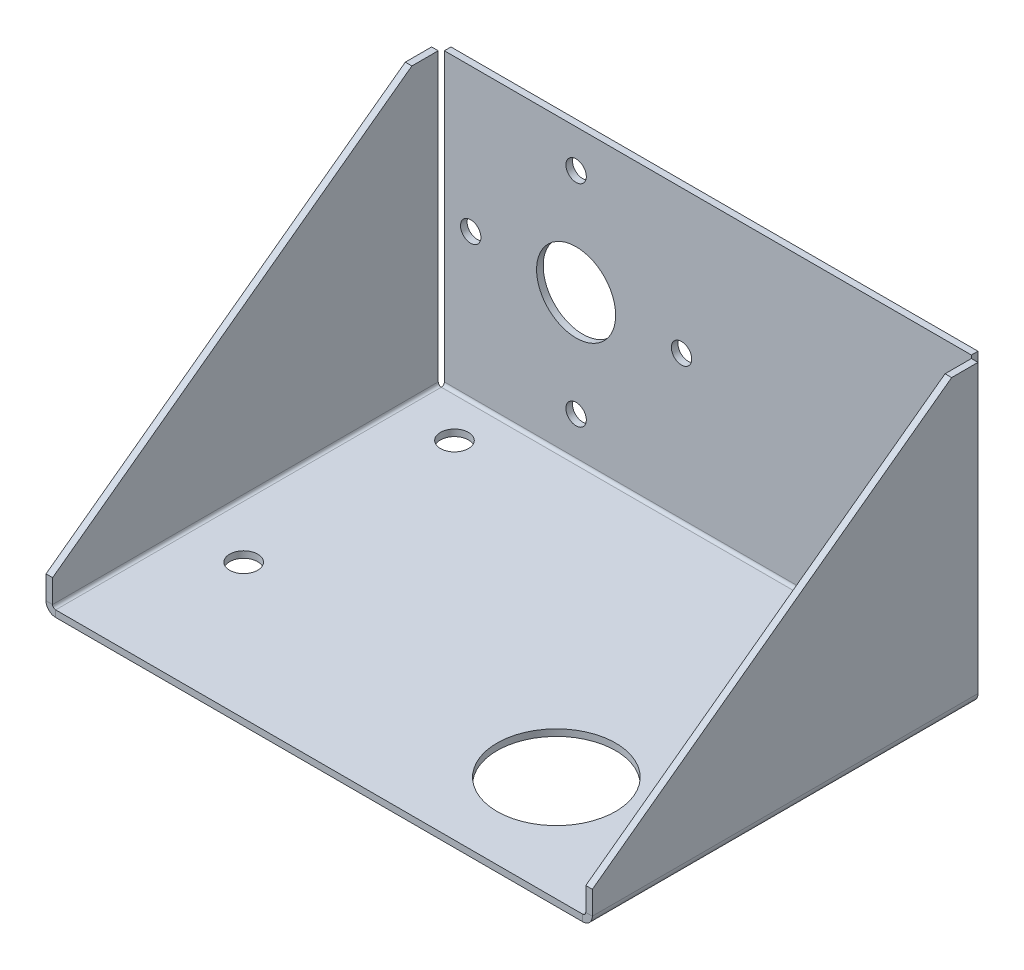
from build123d import *

# Parameters (mm, degrees)
BASE_FLANGE1_DEPTH           = 127
EDGE_FLANGE1_DEPTH           = 92.9259
EDGE_FLANGE1_START           = 1.5875
EDGE_FLANGE1_FLAT_DEPTH      = 1.5875
EDGE_FLANGE1_BEND_DEPTH      = 92.9259
EDGE_FLANGE1_FLAT_2_DEPTH    = 1.5875
SKETCH15_R                   = 14.2875
CUT_EXTRUDE1_DEPTH           = 176.146532483
SKETCH16_R                   = 3.3782
CUT_EXTRUDE2_DEPTH           = 176.146532483
SKETCH17_R                   = 9.525
CUT_EXTRUDE3_DEPTH           = 175.288293488
F_10_0_1935_DIAMETER_HOLE1_D = 4.9149


# Sheet-metal steps are written as plain solids
with BuildPart() as part:
    # Sketch1 → Base-Flange1 (new body)
    with BuildSketch(Plane(origin=(0, 0, 0), x_dir=(0, 0, -1), z_dir=(1, 0, 0))):
        with BuildLine():
            Line((0, 0), (92.9259, 0))
            ThreePointArc((92.9259, 0), (93.446754855, 0.215745145), (93.6625, 0.7366))
            Line((93.6625, 0.7366), (93.6625, 69.85))
            Line((93.6625, 69.85), (95.25, 69.85))
            Line((95.25, 69.85), (95.25, 0.7366))
            ThreePointArc((95.25, 0.7366), (94.56928687, -0.90678687), (92.9259, -1.5875))
            Line((92.9259, -1.5875), (0, -1.5875))
            Line((0, -1.5875), (0, 0))
        make_face()
    extrude(amount=BASE_FLANGE1_DEPTH)

    # Edge-Flange1 bend section (across the edge) → Edge-Flange1 (add)
    with BuildSketch(Plane(origin=(-0.7366, 0, -92.9259), x_dir=(1, 0, 0), z_dir=(0, 0, 1))):
        with BuildLine():
            Line((-1.5875, 0.7366), (0, 0.7366))
            ThreePointArc((0, 0.7366), (0.215745145, 0.215745145), (0.7366, 0))
            Line((0.7366, 0), (0.7366, -1.5875))
            ThreePointArc((0.7366, -1.5875), (-0.90678687, -0.90678687), (-1.5875, 0.7366))
        make_face()
    extrude(amount=EDGE_FLANGE1_DEPTH)

    # Edge-Flange1 profile (on flange) → Edge-Flange1 flat (add)
    with BuildSketch(Plane.ZY.offset(0.7366).offset(EDGE_FLANGE1_START)):
        Polygon((0, 0.7366), (0, 6.35), (-86.5759, 69.85), (-92.9259, 69.85), (-92.9259, 0.7366), align=None)
    extrude(amount=-EDGE_FLANGE1_FLAT_DEPTH)

    # Edge-Flange1 bend section 2 (across the edge) → Edge-Flange1 bend (add)
    with BuildSketch(Plane(origin=(127.7366, 0, 0), x_dir=(-1, 0, 0), z_dir=(0, 0, -1))):
        with BuildLine():
            Line((-1.5875, 0.7366), (0, 0.7366))
            ThreePointArc((0, 0.7366), (0.215745145, 0.215745145), (0.7366, 0))
            Line((0.7366, 0), (0.7366, -1.5875))
            ThreePointArc((0.7366, -1.5875), (-0.90678687, -0.90678687), (-1.5875, 0.7366))
        make_face()
    extrude(amount=EDGE_FLANGE1_BEND_DEPTH)

    # Edge-Flange1 profile 2 (on flange) → Edge-Flange1 flat 2 (add)
    with BuildSketch(Plane(origin=(127.7366, 0, 0), x_dir=(0, 0, -1), z_dir=(1, 0, 0)).offset(EDGE_FLANGE1_START)):
        Polygon((0, 6.35), (0, 0.7366), (92.9259, 0.7366), (92.9259, 69.85), (86.5759, 69.85), align=None)
    extrude(amount=-EDGE_FLANGE1_FLAT_2_DEPTH)

    # Sketch15 → Cut-Extrude1 (cut, through all)
    with BuildSketch(Plane(origin=(0, 0, 0), x_dir=(1, 0, 0), z_dir=(0, 1, 0))):
        with Locations(Location((95.25, 25.4, 0), (0, 0, 270))):
            Circle(SKETCH15_R)
    extrude(amount=-CUT_EXTRUDE1_DEPTH, mode=Mode.SUBTRACT)

    # Sketch16 → Cut-Extrude2 (cut, through all)
    with BuildSketch(Plane(origin=(0, 0, 0), x_dir=(1, 0, 0), z_dir=(0, 1, 0))):
        with Locations(Location((12.7, 83.4009, 0), (0, 0, 270))):
            Circle(SKETCH16_R)
        with Locations(Location((121.92, 83.4009, 0), (0, 0, 270))):
            Circle(SKETCH16_R)
        with Locations(Location((121.92, 32.6009, 0), (0, 0, 270))):
            Circle(SKETCH16_R)
        with Locations(Location((12.7, 32.6009, 0), (0, 0, 270))):
            Circle(SKETCH16_R)
    extrude(amount=-CUT_EXTRUDE2_DEPTH, mode=Mode.SUBTRACT)

    # Sketch17 → Cut-Extrude3 (cut, through all)
    with BuildSketch(Plane.XY.offset(-93.6625)):
        with Locations((31.75, 35.2933)):
            Circle(SKETCH17_R)
    extrude(amount=-CUT_EXTRUDE3_DEPTH, mode=Mode.SUBTRACT)

    # #10 (0.1935) Diameter Hole1 (through all)
    with Locations(Plane(origin=(0, 0, -95.25), x_dir=(-1, 0, 0), z_dir=(0, 0, -1))):
        with Locations((-31.75, 60.6933), (-6.35, 35.2933), (-31.75, 9.8933), (-57.15, 35.2933)):
            Hole(F_10_0_1935_DIAMETER_HOLE1_D / 2)


solid = part.part
